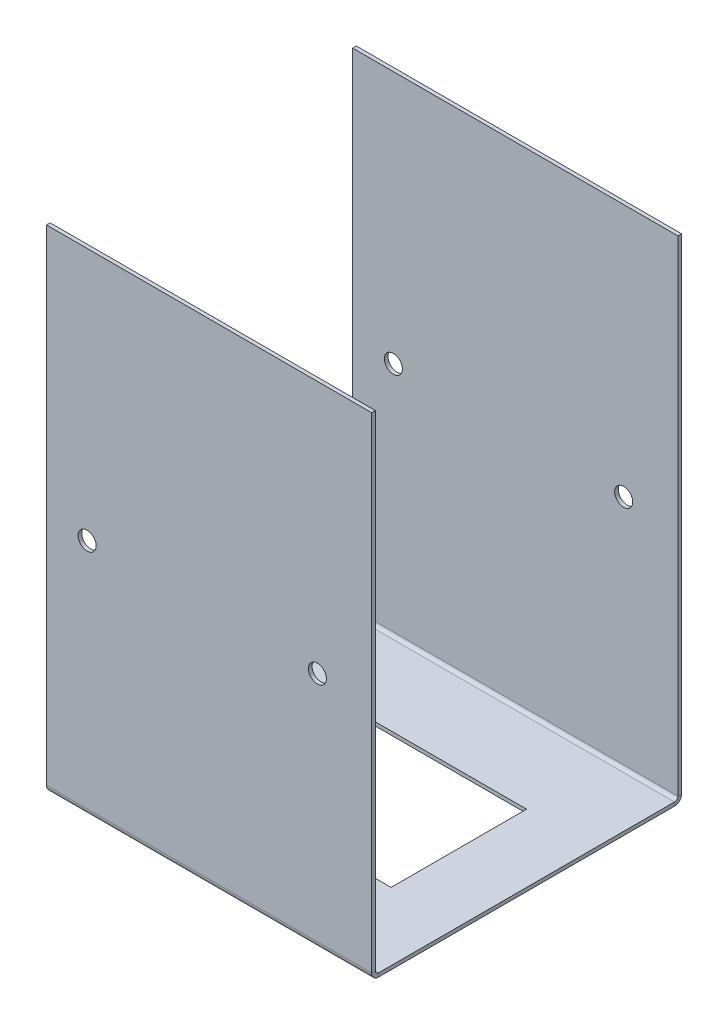
from build123d import *

# Parameters (mm, degrees)
SKETCH1_W                      = 72
SKETCH1_H                      = 67
BASE_FLANGE1_DEPTH             = 0.81
EDGE_FLANGE1_STRIP_W           = 4.7132
EDGE_FLANGE1_STRIP_H           = 0.81
EDGE_FLANGE1_STRIP_CUT_DEPTH   = 72
EDGE_FLANGE1_STRIP_2_W         = 4.7132
EDGE_FLANGE1_STRIP_2_H         = 0.81
EDGE_FLANGE1_STRIP_CUT_2_DEPTH = 72
EDGE_FLANGE1_DEPTH             = 72
EDGE_FLANGE1_BEND_DEPTH        = 72
CUT_EXTRUDE1_REACH             = 148.585
SKETCH12_W                     = 42
SKETCH12_H                     = 30
CUT_EXTRUDE2_REACH             = 148.962
SKETCH13_R                     = 2


# Sheet-metal steps are written as plain solids
with BuildPart() as part:
    # Sketch1 → Base-Flange1 (new body)
    with BuildSketch(Plane(origin=(0, 0, 0), x_dir=(1, 0, 0), z_dir=(0, 1, 0))):
        with Locations((36, 33.5)):
            Rectangle(SKETCH1_W, SKETCH1_H)
    extrude(amount=-BASE_FLANGE1_DEPTH)

    # Edge-Flange1 strip (across the edge) → Edge-Flange1 strip cut (cut)
    with BuildSketch(Plane(origin=(0, 0, 0), x_dir=(0, 0, -1), z_dir=(1, 0, 0))):
        with Locations((-1.62, -0.405)):
            Rectangle(EDGE_FLANGE1_STRIP_W, EDGE_FLANGE1_STRIP_H)
    extrude(amount=EDGE_FLANGE1_STRIP_CUT_DEPTH, mode=Mode.SUBTRACT)

    # Edge-Flange1 strip 2 (across the edge) → Edge-Flange1 strip cut 2 (cut)
    with BuildSketch(Plane(origin=(72, 0, -67), x_dir=(0, 0, 1), z_dir=(-1, 0, 0))):
        with Locations((-1.62, -0.405)):
            Rectangle(EDGE_FLANGE1_STRIP_2_W, EDGE_FLANGE1_STRIP_2_H)
    extrude(amount=EDGE_FLANGE1_STRIP_CUT_2_DEPTH, mode=Mode.SUBTRACT)

    # Edge-Flange1 section (across the edge) → Edge-Flange1 (add)
    with BuildSketch(Plane(origin=(0, 0, 0), x_dir=(0, 0, -1), z_dir=(1, 0, 0))):
        with BuildLine():
            Line((-0.81, 0.7366), (-0.81, 108.19))
            Line((-0.81, 108.19), (0, 108.19))
            Line((0, 108.19), (0, 0.7366))
            ThreePointArc((0, 0.7366), (0.215745145, 0.215745145), (0.7366, 0))
            Line((0.7366, 0), (0.7366, -0.81))
            ThreePointArc((0.7366, -0.81), (-0.357011348, -0.357011348), (-0.81, 0.7366))
        make_face()
    extrude(amount=EDGE_FLANGE1_DEPTH)

    # Edge-Flange1 section 2 (across the edge) → Edge-Flange1 bend (add)
    with BuildSketch(Plane(origin=(72, 0, -67), x_dir=(0, 0, 1), z_dir=(-1, 0, 0))):
        with BuildLine():
            Line((-0.81, 0.7366), (-0.81, 108.19))
            Line((-0.81, 108.19), (0, 108.19))
            Line((0, 108.19), (0, 0.7366))
            ThreePointArc((0, 0.7366), (0.215745145, 0.215745145), (0.7366, 0))
            Line((0.7366, 0), (0.7366, -0.81))
            ThreePointArc((0.7366, -0.81), (-0.357011348, -0.357011348), (-0.81, 0.7366))
        make_face()
    extrude(amount=EDGE_FLANGE1_BEND_DEPTH)

    # Sketch12 → Cut-Extrude1 (cut, up to next)
    with BuildSketch(Plane(origin=(0, 0, 0), x_dir=(1, 0, 0), z_dir=(0, 1, 0)), mode=Mode.PRIVATE) as cut_extrude1_sk1:
        with Locations((36, 33.5)):
            Rectangle(SKETCH12_W, SKETCH12_H)
    cut_extrude1_tool1 = extrude(cut_extrude1_sk1.sketch, amount=-CUT_EXTRUDE1_REACH, mode=Mode.PRIVATE) & part.part
    add(cut_extrude1_tool1.solids().sort_by_distance((36, 0, -33.5))[0], mode=Mode.SUBTRACT)

    # Cut-Extrude2: up to this face of the body (flat: up to its plane)
    cut_extrude2_end = Plane(part.part.faces().sort_by_distance((36, 54.4633, 0.81))[0])
    # Sketch13 → Cut-Extrude2 (cut, up to the picked face)
    with BuildSketch(Plane(origin=(0, 0, -67.81), x_dir=(-1, 0, 0), z_dir=(0, 0, -1)), mode=Mode.PRIVATE) as cut_extrude2_sk1:
        with Locations(Location((-9, 52.1466, 0), (0, 0, 90))):
            Circle(SKETCH13_R)
    cut_extrude2_tool1 = split(extrude(cut_extrude2_sk1.sketch, amount=-CUT_EXTRUDE2_REACH, mode=Mode.PRIVATE), bisect_by=cut_extrude2_end, keep=Keep.BOTH, mode=Mode.PRIVATE)
    # Sketch13 → Cut-Extrude2 (cut, up to the picked face)
    with BuildSketch(Plane(origin=(0, 0, -67.81), x_dir=(-1, 0, 0), z_dir=(0, 0, -1)), mode=Mode.PRIVATE) as cut_extrude2_sk2:
        with Locations(Location((-60, 52.1466, 0), (0, 0, 90))):
            Circle(SKETCH13_R)
    cut_extrude2_tool2 = split(extrude(cut_extrude2_sk2.sketch, amount=-CUT_EXTRUDE2_REACH, mode=Mode.PRIVATE), bisect_by=cut_extrude2_end, keep=Keep.BOTH, mode=Mode.PRIVATE)
    add(cut_extrude2_tool1.solids().sort_by(Axis((9, 52.1466, -67.81), (0, 0, 1)))[0], mode=Mode.SUBTRACT)
    add(cut_extrude2_tool2.solids().sort_by(Axis((60, 52.1466, -67.81), (0, 0, 1)))[0], mode=Mode.SUBTRACT)


solid = part.part
